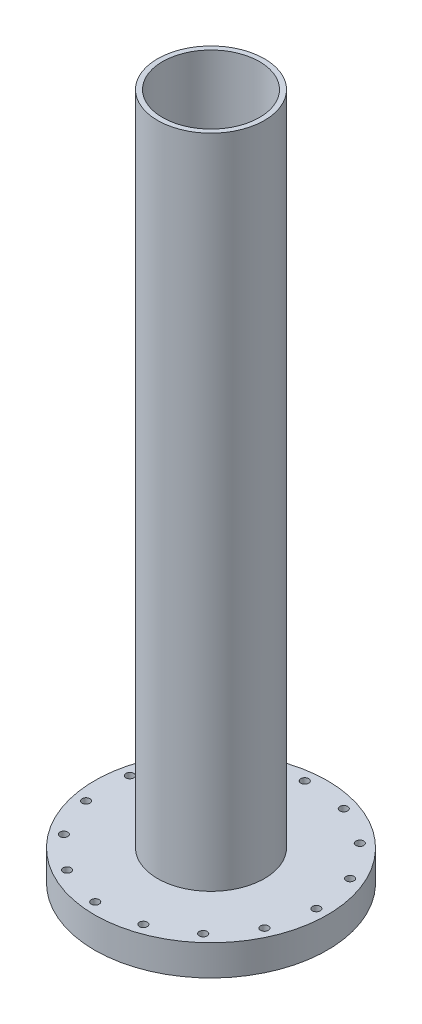
from build123d import *

# Parameters (mm, degrees)
SKETCH1_R           = 35
SKETCH1_R_2         = 31.75
BOSS_EXTRUDE1_DEPTH = 450
SKETCH2_R           = 76.2
SKETCH2_R_2         = 31.75
BOSS_EXTRUDE2_DEPTH = 20
SKETCH5_W           = 2.579751
SKETCH5_H           = 450
CIRPATTERN1_COUNT   = 15
SKETCH6_R           = 55.14
CUT_EXTRUDE1_DEPTH  = 2


with BuildPart() as part:
    # Sketch1 → Boss-Extrude1 (new body)
    with BuildSketch(Plane(origin=(0, 0, 0), x_dir=(1, 0, 0), z_dir=(0, 1, 0))):
        Circle(SKETCH1_R)
        Circle(SKETCH1_R_2, mode=Mode.SUBTRACT)
    extrude(amount=BOSS_EXTRUDE1_DEPTH)


with BuildPart() as body_2:
    # Sketch2 → Boss-Extrude2 (new body)
    with BuildSketch(Plane(origin=(0, 0, 0), x_dir=(1, 0, 0), z_dir=(0, 1, 0))):
        Circle(SKETCH2_R)
        Circle(SKETCH2_R_2, mode=Mode.SUBTRACT)
    extrude(amount=BOSS_EXTRUDE2_DEPTH)

    # Sketch5 → 13/64 (0.20313) Diameter Hole1 (revolve, cut)
    with BuildSketch(Plane(origin=(69, 0, 0), x_dir=(0, 0, -1), z_dir=(1, 0, 0))):
        with Locations((1.2898755, 225)):
            Rectangle(SKETCH5_W, SKETCH5_H)
    f_13_64_0_20313_diameter_hole1 = revolve(axis=Axis((69, -6.35, 0), (0, 1, 0)), mode=Mode.SUBTRACT)

    # CirPattern1: 13/64 (0.20313) Diameter Hole1 ×15 about axis
    cirpattern1_axis = Axis((0, 472.5, 0), (0, -1, 0))
    for i in range(1, CIRPATTERN1_COUNT):
        add(f_13_64_0_20313_diameter_hole1.rotate(cirpattern1_axis, i * 360 / CIRPATTERN1_COUNT), mode=Mode.SUBTRACT)


with BuildPart() as cut_extrude1_tool:
    # Sketch6 → Cut-Extrude1 (new body)
    with BuildSketch(Plane.XZ):
        Circle(SKETCH6_R)
    extrude(amount=-CUT_EXTRUDE1_DEPTH)


with BuildPart() as part_1:
    add(part.part)

    # Cut-Extrude1: cut by cut_extrude1_tool
    add(cut_extrude1_tool.part, mode=Mode.SUBTRACT)


with BuildPart() as body_2_1:
    add(body_2.part)

    # Cut-Extrude1: cut by cut_extrude1_tool
    add(cut_extrude1_tool.part, mode=Mode.SUBTRACT)


solid = Compound([part_1.part, body_2_1.part])
